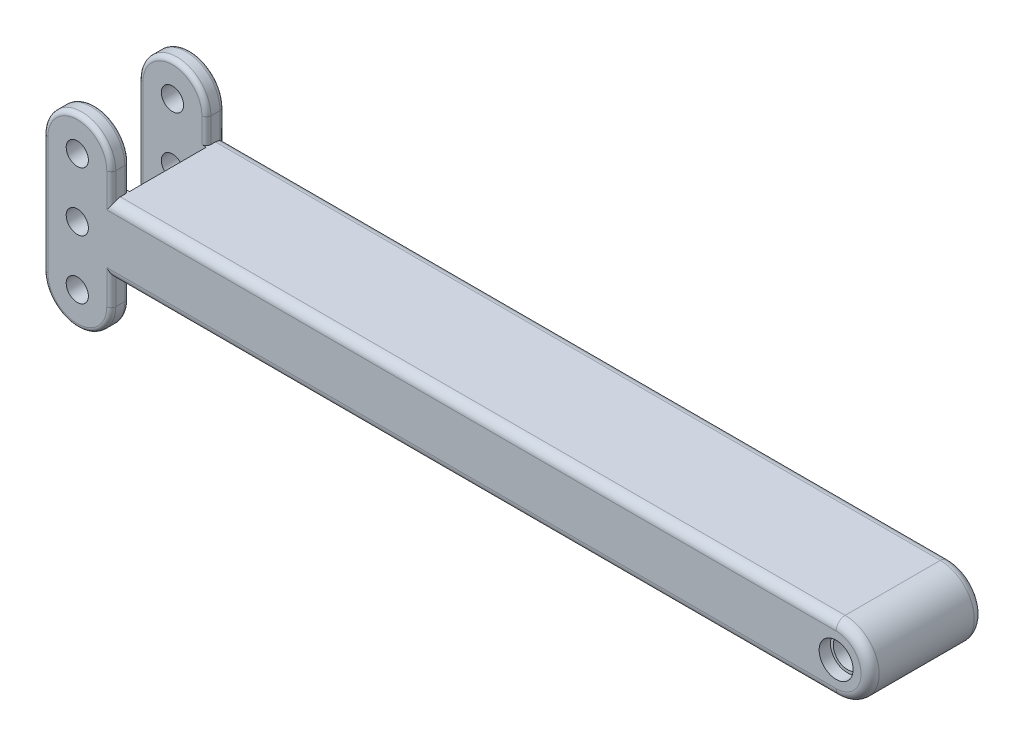
from build123d import *

# Parameters (mm, degrees)
SKETCH1_R           = 3.1115
SKETCH1_R_2         = 3.96875
BOSS_EXTRUDE1_DEPTH = 31.75
SKETCH2_W           = 21.59
SKETCH2_H           = 52.07
CUT_EXTRUDE1_DEPTH  = 19.05
FILLET1_R           = 2.54
FILLET2_R           = 1.27
CUT_EXTRUDE2_START  = -3.175
SKETCH3_R           = 4.7625
SKETCH3_R_2         = 3.96875
CUT_EXTRUDE2_DEPTH  = 3.175


with BuildPart() as part:
    # Sketch1 → Boss-Extrude1 (new body)
    with BuildSketch(Plane.XY):
        with BuildLine():
            Line((-9.525, 33.02), (-9.525, 0))
            ThreePointArc((-9.525, 0), (0, -9.525), (9.525, 0))
            Line((9.525, 0), (9.525, 6.985))
            Line((9.525, 6.985), (212.725, 6.985))
            ThreePointArc((212.725, 6.985), (222.25, 16.51), (212.725, 26.035))
            Line((212.725, 26.035), (9.525, 26.035))
            Line((9.525, 26.035), (9.525, 33.02))
            ThreePointArc((9.525, 33.02), (0, 42.545), (-9.525, 33.02))
        make_face()
        Circle(SKETCH1_R, mode=Mode.SUBTRACT)
        with Locations((0, 16.51)):
            Circle(SKETCH1_R, mode=Mode.SUBTRACT)
        with Locations((0, 33.02)):
            Circle(SKETCH1_R, mode=Mode.SUBTRACT)
        with Locations((212.725, 16.51)):
            Circle(SKETCH1_R_2, mode=Mode.SUBTRACT)
    extrude(amount=BOSS_EXTRUDE1_DEPTH)

    # Sketch2 → Cut-Extrude1 (cut)
    with BuildSketch(Plane.ZY.offset(9.525)):
        with Locations((15.875, 16.51)):
            Rectangle(SKETCH2_W, SKETCH2_H)
    extrude(amount=-CUT_EXTRUDE1_DEPTH, mode=Mode.SUBTRACT)

    # Fillet1
    fillet1_edges = [part.edges().sort_by_distance(p)[0] for p in [
        (111.125, 26.035, 0),
        (222.25, 16.51, 0),
        (111.125, 26.035, 31.75),
        (222.25, 16.51, 31.75),
        (111.125, 6.985, 0),
        (111.125, 6.985, 31.75),
    ]]
    fillet(fillet1_edges, radius=FILLET1_R)

    # Fillet2
    fillet2_edges = [part.edges().sort_by_distance(p)[0] for p in [
        (9.525, 3.4925, 26.67),
        (9.525, 29.5275, 26.67),
        (0, 42.545, 26.67),
        (-9.525, 16.51, 26.67),
        (9.525, 28.2575, 0),
        (0, 42.545, 0),
        (-9.525, 16.51, 0),
        (9.525, 4.7625, 0),
        (9.525, 3.4925, 5.08),
        (9.525, 29.5275, 5.08),
        (0, 42.545, 5.08),
        (-9.525, 16.51, 5.08),
        (9.525, 28.2575, 31.75),
        (0, 42.545, 31.75),
        (-9.525, 16.51, 31.75),
        (9.525, 4.7625, 31.75),
        (0, -9.525, 26.67),
        (0, -9.525, 0),
        (0, -9.525, 5.08),
        (0, -9.525, 31.75),
    ]]
    fillet(fillet2_edges, radius=FILLET2_R)

    # Sketch3 → Cut-Extrude2 (cut)
    with BuildSketch(Plane.XY.offset(31.75).offset(CUT_EXTRUDE2_START)):
        with Locations((212.725, 16.51)):
            Circle(SKETCH3_R)
        with Locations((212.725, 16.51)):
            Circle(SKETCH3_R_2, mode=Mode.SUBTRACT)
    cut_extrude2 = extrude(amount=CUT_EXTRUDE2_DEPTH, mode=Mode.SUBTRACT)

    # Mirror1: Cut-Extrude2 across plane
    add(cut_extrude2.mirror(Plane.XY.offset(15.875)), mode=Mode.SUBTRACT)


solid = part.part
